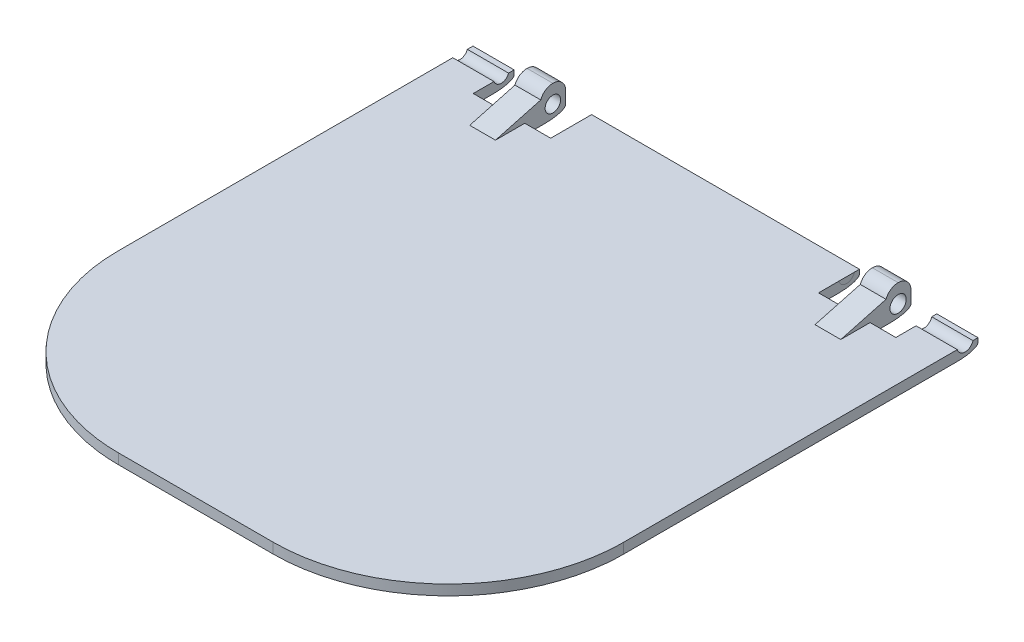
from build123d import *

# Parameters (mm, degrees)
BOSS_EXTRUDE1_DEPTH     = 2
SKETCH5_W               = 4
SKETCH5_H               = 2
CUT_EXTRUDE3_DEPTH      = 123
FILLET3_SIZE            = 4
FILLET3_SIZE_2          = 1.2
SKETCH6_W               = 5
SKETCH6_H               = 5
BOSS_EXTRUDE3_DEPTH     = 4
FILLET4_R               = 2.5
CUT_EXTRUDE7_DEPTH      = 23
CUT_EXTRUDE7_DEPTH_BACK = 10
SKETCH7_R               = 1.5
CUT_EXTRUDE8_DEPTH      = 103
CUT_EXTRUDE8_DEPTH_BACK = 10
SKETCH8_R               = 1.578894268
SKETCH11_W              = 5
SKETCH11_H              = 7.941397329
SKETCH11_W_2            = 5.025588604
SKETCH11_W_3            = 4.996681142
SKETCH11_W_4            = 5.000407309
CUT_EXTRUDE10_DEPTH     = 2
BOSS_EXTRUDE9_DEPTH     = 5
BOSS_EXTRUDE10_DEPTH    = 5


# Some blends are built 0.0001 mm under size
with BuildPart() as part:
    # Sketch1 → Boss-Extrude1 (new body)
    with BuildSketch(Plane(origin=(0, 0, 0), x_dir=(1, 0, 0), z_dir=(0, 1, 0))):
        with BuildLine():
            Line((-124.990139359, 1941.929047201), (-26.990139359, 1941.929047201))
            Line((-26.990139359, 1941.929047201), (-26.990139359, 1869.177480284))
            add(Edge.make_bspline(
                [(-26.990139359, 1869.177480284), (-26.971518988, 1862.10424426), (-30.008687271, 1852.889636427), (-37.937395583, 1843.840603399), (-46.643299948, 1837.427446423), (-55.223933615, 1835.160216105), (-61.011506847, 1835.177480284)],
                knots=[0, 0, 0, 0, 0.39690732, 0.518030206, 0.674278755, 1, 1, 1, 1], degree=3))
            Line((-61.011506847, 1835.177480284), (-91.011506847, 1835.177480284))
            add(Edge.make_bspline(
                [(-124.990139359, 1869.177480284), (-125.031653114, 1863.882416947), (-123.319081347, 1856.812557982), (-118.175654079, 1848.334494738), (-113.169582942, 1842.947577461), (-104.127691798, 1837.037384536), (-96.235416895, 1835.16563891), (-91.011506847, 1835.177480284)],
                knots=[0, 0, 0, 0, 0.297124953, 0.397302783, 0.556358073, 0.706503021, 1, 1, 1, 1], degree=3))
            Line((-124.990139359, 1869.177480284), (-124.990139359, 1941.929047201))
        make_face()
    extrude(amount=BOSS_EXTRUDE1_DEPTH)

    # Sketch5 → Cut-Extrude3 (cut)
    with BuildSketch(Plane(origin=(-26.990139359, 0, 0), x_dir=(0, 0, -1), z_dir=(1, 0, 0))):
        with Locations((1939.929047201, 1)):
            Rectangle(SKETCH5_W, SKETCH5_H)
    extrude(amount=-CUT_EXTRUDE3_DEPTH, mode=Mode.SUBTRACT)

    # Fillet3
    # an asymmetric fillet: 4, 1.2 mm, written as the material it takes off along each edge
    with BuildSketch(Plane(origin=(-16.990139359, 0, -1937.929047201), x_dir=(0, 0, 1), z_dir=(-1, 0, 0))) as fillet3_piece_1:
        with BuildLine():
            Bezier((FILLET3_SIZE, 0), (0, 0), (0, FILLET3_SIZE_2), weights=[1, 0.707106781, 1])
            Line((0, FILLET3_SIZE_2), (0, 0))
            Line((0, 0), (FILLET3_SIZE, 0))
        make_face()
    extrude(amount=118, mode=Mode.SUBTRACT)

    # Sketch6 → Boss-Extrude3 (add)
    with BuildSketch(Plane(origin=(0, 2, 0), x_dir=(1, 0, 0), z_dir=(0, 1, 0))):
        with Locations((-42.490139359, 1935.429047201)):
            Rectangle(SKETCH6_W, SKETCH6_H)
        with Locations((-109.490139359, 1935.429047201)):
            Rectangle(SKETCH6_W, SKETCH6_H)
    extrude(amount=BOSS_EXTRUDE3_DEPTH)

    # Fillet4
    fillet4_edges = [part.edges().sort_by_distance(p)[0] for p in [
        (-42.490139359, 6, -1932.929047201),
        (-42.490139359, 6, -1937.929047201),
        (-109.490139359, 6, -1932.929047201),
        (-109.490139359, 6, -1937.929047201),
    ]]
    fillet(fillet4_edges, radius=FILLET4_R - 0.0001)  # a hair under: the kernel refuses the full size

    # Sketch7 → Cut-Extrude7 (cut, two sides: drawn at the far end of the back side and taken through both)
    with BuildSketch(Plane.ZY.offset(111.990139359).offset(-CUT_EXTRUDE7_DEPTH_BACK)):
        with Locations(Location((-1935.429047201, 2.500019457, 0), (0, 0, 199.472008932))):
            Circle(SKETCH7_R)
    extrude(amount=CUT_EXTRUDE7_DEPTH + CUT_EXTRUDE7_DEPTH_BACK, mode=Mode.SUBTRACT)

    # Sketch8 → Cut-Extrude8 (cut, two sides: drawn at the far end of the back side and taken through both)
    with BuildSketch(Plane(origin=(-39.990139359, 0, 0), x_dir=(0, 0, -1), z_dir=(1, 0, 0)).offset(-CUT_EXTRUDE8_DEPTH_BACK)):
        with Locations(Location((1935.429047201, 2.421125189, 0), (0, 0, 195.469275058))):
            Circle(SKETCH8_R)
    extrude(amount=CUT_EXTRUDE8_DEPTH + CUT_EXTRUDE8_DEPTH_BACK, mode=Mode.SUBTRACT)

    # Sketch11 → Cut-Extrude10 (cut)
    with BuildSketch(Plane(origin=(0, 2, 0), x_dir=(1, 0, 0), z_dir=(0, 1, 0))):
        with Locations((-114.490139359, 1933.958348537)):
            Rectangle(SKETCH11_W, SKETCH11_H)
        with Locations((-104.477345057, 1933.958348537)):
            Rectangle(SKETCH11_W_2, SKETCH11_H)
        with Locations((-47.48847993, 1933.958348537)):
            Rectangle(SKETCH11_W_3, SKETCH11_H)
        with Locations((-37.489935704, 1933.958348537)):
            Rectangle(SKETCH11_W_4, SKETCH11_H)
    extrude(amount=-CUT_EXTRUDE10_DEPTH, mode=Mode.SUBTRACT)

    # Sketch12 → Boss-Extrude9 (add)
    with BuildSketch(Plane.ZY.offset(111.990139359)):
        with BuildLine():
            Line((-1924.299895593, 2), (-1934.170448036, 4.660075958))
            add(Edge.make_bspline(
                [(-1934.170448036, 4.660075958), (-1933.941696195, 4.343587233), (-1933.419980381, 3.982722954), (-1933.044506849, 2.985103355), (-1932.921466188, 2.346520539), (-1933.020256273, 1.890017898)],
                knots=[0, 0, 0, 0, 0.374528061, 0.57386245, 1, 1, 1, 1], degree=3))
            Line((-1933.020256273, 1.890017898), (-1924.299895593, 2))
        make_face()
    extrude(amount=-BOSS_EXTRUDE9_DEPTH)

    # Sketch13 → Boss-Extrude10 (add)
    with BuildSketch(Plane(origin=(-39.990139359, 0, 0), x_dir=(0, 0, -1), z_dir=(1, 0, 0))):
        Polygon((1933.084337522, 4.367373347), (1924.299895593, 2), (1933.057886548, 2), (1933.341968005, 3.330037979), (1934.06795395, 4.267766953), (1934.612443409, 4.7319029), align=None)
    extrude(amount=-BOSS_EXTRUDE10_DEPTH)


solid = part.part
